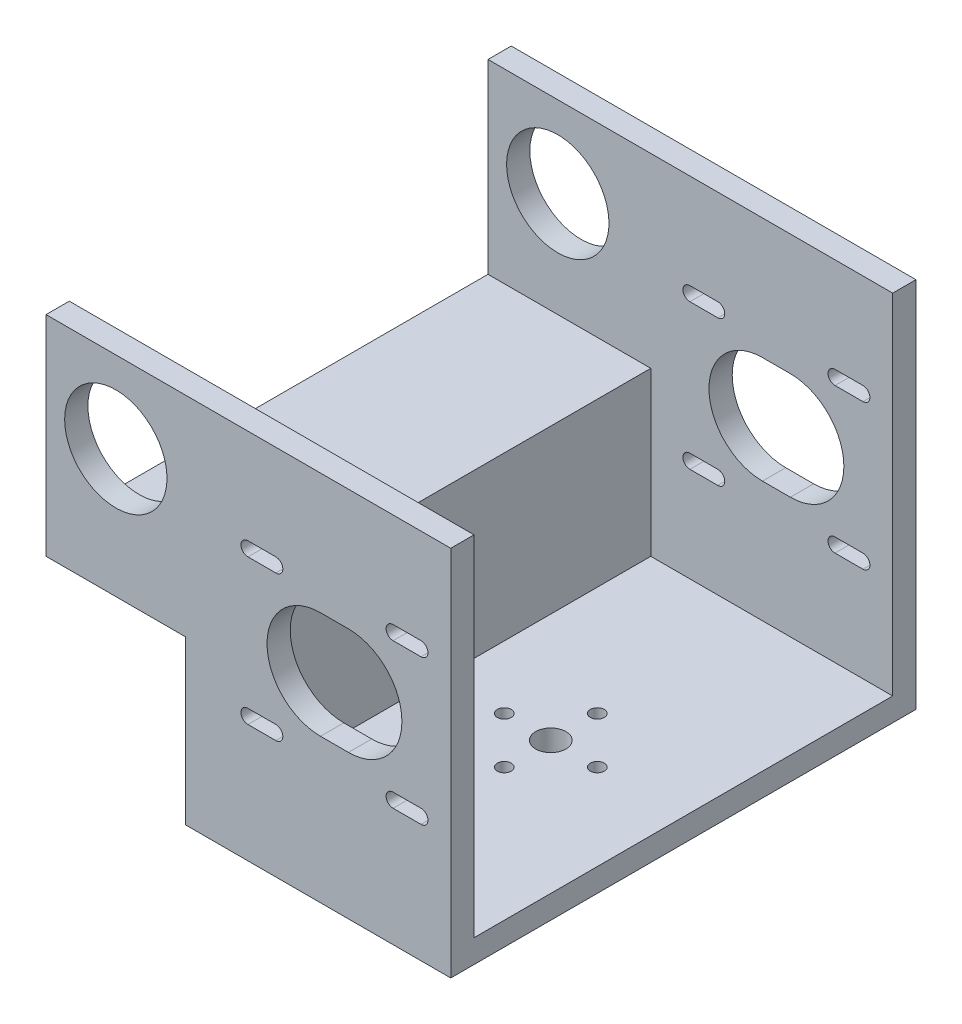
from build123d import *

# Parameters (mm, degrees)
SKETCH1_W           = 57
SKETCH1_H           = 100
BOSS_EXTRUDE1_DEPTH = 80
SKETCH3_W           = 75
SKETCH3_H           = 90
CUT_EXTRUDE1_DEPTH  = 52
SKETCH4_R           = 3.25
SKETCH4_R_2         = 1.5
CUT_EXTRUDE2_DEPTH  = 114.213294272
BOSS_EXTRUDE2_DEPTH = 30
CUT_EXTRUDE5_REACH  = 112.223
SKETCH8_W           = 90
SKETCH8_H           = 40
SKETCH5_R           = 11
CUT_EXTRUDE3_DEPTH  = 141.791512528


with BuildPart() as part:
    # Sketch1 → Boss-Extrude1 (new body)
    with BuildSketch(Plane(origin=(0, 0, 0), x_dir=(1, 0, 0), z_dir=(0, 1, 0))):
        Rectangle(SKETCH1_W, SKETCH1_H)
    extrude(amount=BOSS_EXTRUDE1_DEPTH)

    # Sketch3 → Cut-Extrude1 (cut)
    with BuildSketch(Plane(origin=(28.5, 40, 0), x_dir=(0, 1, 0), z_dir=(-1, 0, 0))):
        with Locations((2.5, 0)):
            Rectangle(SKETCH3_W, SKETCH3_H)
    extrude(amount=CUT_EXTRUDE1_DEPTH, mode=Mode.SUBTRACT)

    # Sketch4 → Cut-Extrude2 (cut, through all)
    with BuildSketch(Plane(origin=(-40, 5, 0), x_dir=(-1, 0, 0), z_dir=(0, -1, 0))):
        with Locations((-40, 0)):
            Circle(SKETCH4_R)
        with Locations((-40, 10)):
            Circle(SKETCH4_R_2)
        with Locations((-30, 0)):
            Circle(SKETCH4_R_2)
        with Locations((-40, -10)):
            Circle(SKETCH4_R_2)
        with Locations((-50, 0)):
            Circle(SKETCH4_R_2)
    extrude(amount=CUT_EXTRUDE2_DEPTH, mode=Mode.SUBTRACT)

    # Sketch7 → Boss-Extrude2 (add)
    with BuildSketch(Plane.ZY.offset(28.5)):
        Polygon((-50, 80), (-45, 80), (-45, 40), (45, 40), (45, 80), (50, 80), (50, 35), (-50, 35), align=None)
    extrude(amount=BOSS_EXTRUDE2_DEPTH)

    # Sketch8 → Cut-Extrude5 (cut, up to next)
    with BuildSketch(Plane.ZY.offset(28.5), mode=Mode.PRIVATE) as cut_extrude5_sk1:
        with Locations((0, 60)):
            Rectangle(SKETCH8_W, SKETCH8_H)
    cut_extrude5_tool1 = extrude(cut_extrude5_sk1.sketch, amount=-CUT_EXTRUDE5_REACH, mode=Mode.PRIVATE) & part.part
    add(cut_extrude5_tool1.solids().sort_by_distance((-28.5, 60, 0))[0], mode=Mode.SUBTRACT)

    # Sketch5 → Cut-Extrude3 (cut, through all)
    with BuildSketch(Plane(origin=(0, 0, -50), x_dir=(-1, 0, 0), z_dir=(0, 0, -1))):
        with Locations((43.5, 62.5)):
            Circle(SKETCH5_R)
        with BuildLine():
            Line((-22.1, 59.6), (-16.1, 59.6))
            ThreePointArc((-16.1, 59.6), (-14.6, 58.1), (-16.1, 56.6))
            Line((-16.1, 56.6), (-22.1, 56.6))
            ThreePointArc((-22.1, 56.6), (-23.6, 58.1), (-22.1, 59.6))
        make_face()
        with BuildLine():
            Line((-0.5, 31), (-6.5, 31))
            ThreePointArc((-6.5, 31), (-18, 42.5), (-6.5, 54))
            Line((-6.5, 54), (-0.5, 54))
            ThreePointArc((-0.5, 54), (11, 42.5), (-0.5, 31))
        make_face()
        with BuildLine():
            Line((-22.1, 25.4), (-16.1, 25.4))
            ThreePointArc((-16.1, 25.4), (-14.6, 26.9), (-16.1, 28.4))
            Line((-16.1, 28.4), (-22.1, 28.4))
            ThreePointArc((-22.1, 28.4), (-23.6, 26.9), (-22.1, 25.4))
        make_face()
        with BuildLine():
            Line((15.1, 25.4), (9.1, 25.4))
            ThreePointArc((9.1, 25.4), (7.6, 26.9), (9.1, 28.4))
            Line((9.1, 28.4), (15.1, 28.4))
            ThreePointArc((15.1, 28.4), (16.6, 26.9), (15.1, 25.4))
        make_face()
        with BuildLine():
            Line((15.1, 59.6), (9.1, 59.6))
            ThreePointArc((9.1, 59.6), (7.6, 58.1), (9.1, 56.6))
            Line((9.1, 56.6), (15.1, 56.6))
            ThreePointArc((15.1, 56.6), (16.6, 58.1), (15.1, 59.6))
        make_face()
    extrude(amount=-CUT_EXTRUDE3_DEPTH, mode=Mode.SUBTRACT)


solid = part.part
